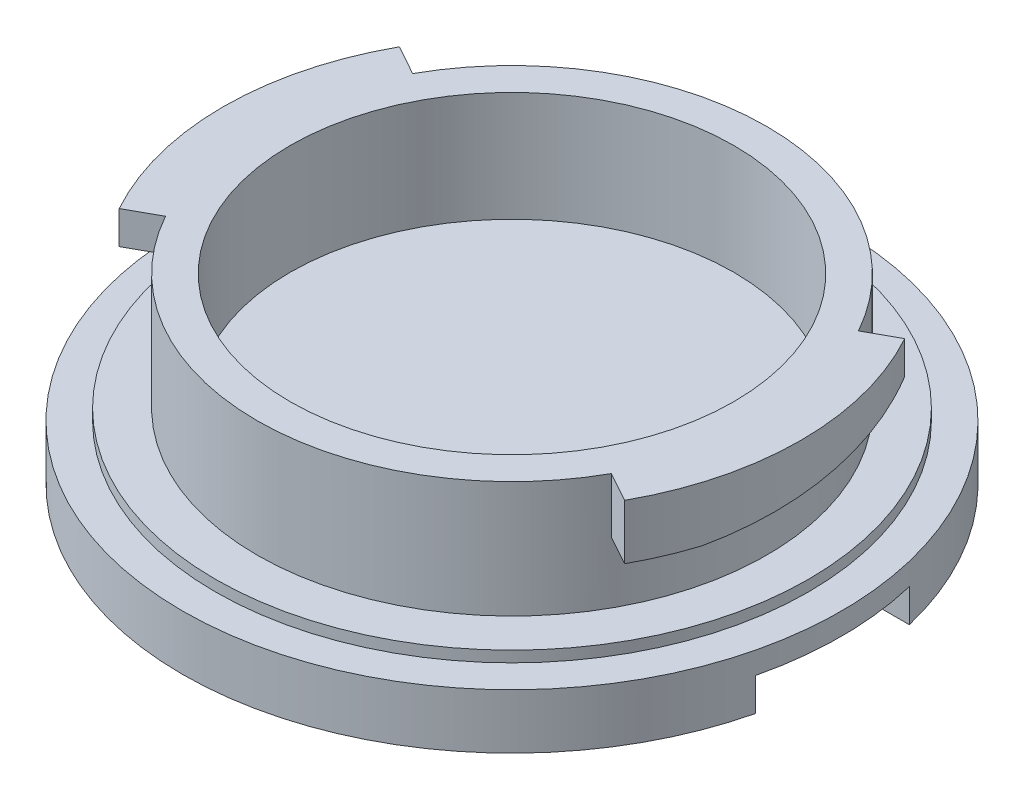
from build123d import *

# Parameters (mm, degrees)
SKETCH1_R           = 15
BOSS_EXTRUDE1_DEPTH = 2.5
SKETCH2_R           = 13.5
BOSS_EXTRUDE2_DEPTH = 0.5
SKETCH3_R           = 11.6
BOSS_EXTRUDE3_DEPTH = 5.3
SKETCH4_R           = 10.1
CUT_EXTRUDE1_DEPTH  = 5
CUT_EXTRUDE2_DEPTH  = 2
BOSS_EXTRUDE4_START = -2.5
BOSS_EXTRUDE4_DEPTH = 2.5
CUT_EXTRUDE3_DEPTH  = 1.5
CHAMFER1_SIZE       = 1.5
CHAMFER3_SIZE       = 1
CHAMFER3_SIZE_2     = 9.514364454


# Some blends are built 0.0001 mm under size
with BuildPart() as part:
    # Sketch1 → Boss-Extrude1 (new body)
    with BuildSketch(Plane(origin=(0, 0, 0), x_dir=(1, 0, 0), z_dir=(0, 1, 0))):
        with Locations(Location((0, 0, 0), (0, 0, 270))):
            Circle(SKETCH1_R)
    extrude(amount=BOSS_EXTRUDE1_DEPTH)

    # Sketch2 → Boss-Extrude2 (add)
    with BuildSketch(Plane(origin=(0, 2.5, 0), x_dir=(1, 0, 0), z_dir=(0, 1, 0))):
        with Locations(Location((0, 0, 0), (0, 0, 270))):
            Circle(SKETCH2_R)
    extrude(amount=BOSS_EXTRUDE2_DEPTH)

    # Sketch3 → Boss-Extrude3 (add)
    with BuildSketch(Plane(origin=(0, 3, 0), x_dir=(1, 0, 0), z_dir=(0, 1, 0))):
        with Locations(Location((0, 0, 0), (0, 0, 270))):
            Circle(SKETCH3_R)
    extrude(amount=BOSS_EXTRUDE3_DEPTH)

    # Sketch4 → Cut-Extrude1 (cut)
    with BuildSketch(Plane(origin=(0, 8.3, 0), x_dir=(1, 0, 0), z_dir=(0, 1, 0))):
        with Locations(Location((0, 0, 0), (0, 0, 270))):
            Circle(SKETCH4_R)
    extrude(amount=-CUT_EXTRUDE1_DEPTH, mode=Mode.SUBTRACT)

    # Sketch6 → Cut-Extrude2 (cut)
    with BuildSketch(Plane.XZ):
        with BuildLine():
            ThreePointArc((9.797958971, 2), (0, 10), (-9.797958971, 2))
            Line((-9.797958971, 2), (9.797958971, 2))
        make_face()
        with BuildLine():
            Line((9.797958971, -2), (-9.797958971, -2))
            ThreePointArc((-9.797958971, -2), (0, -10), (9.797958971, -2))
        make_face()
    extrude(amount=-CUT_EXTRUDE2_DEPTH, mode=Mode.SUBTRACT)

    # Sketch7 → Boss-Extrude4 (add)
    with BuildSketch(Plane(origin=(0, 8.3, 0), x_dir=(1, 0, 0), z_dir=(0, 1, 0)).offset(BOSS_EXTRUDE4_START)):
        with BuildLine():
            ThreePointArc((11.6, 0), (11.230512628, -2.904408047), (10.145588603, -5.623791595))
            Line((10.145588603, -5.623791595), (11.501249149, -6.375246506))
            ThreePointArc((11.501249149, -6.375246506), (12.731141471, -3.292497053), (13.15, 0))
            ThreePointArc((13.15, 0), (12.731141471, 3.292497053), (11.501249149, 6.375246506))
            Line((11.501249149, 6.375246506), (10.145588603, 5.623791595))
            ThreePointArc((10.145588603, 5.623791595), (11.230512628, 2.904408047), (11.6, 0))
        make_face()
        with BuildLine():
            Line((-11.501249149, -6.375246506), (-10.145588603, -5.623791595))
            ThreePointArc((-10.145588603, -5.623791595), (-11.6, 0), (-10.145588603, 5.623791595))
            Line((-10.145588603, 5.623791595), (-11.501249149, 6.375246506))
            ThreePointArc((-11.501249149, 6.375246506), (-13.15, 0), (-11.501249149, -6.375246506))
        make_face()
    extrude(amount=BOSS_EXTRUDE4_DEPTH)

    # Sketch8 → Cut-Extrude3 (cut)
    with BuildSketch(Plane.XZ):
        with BuildLine():
            Line((13, 3.5), (13, -3.5))
            Line((13, -3.5), (14.585952146, -3.5))
            ThreePointArc((14.585952146, -3.5), (14.896128393, -1.762202856), (15, 0))
            ThreePointArc((15, 0), (14.896128393, 1.762202856), (14.585952146, 3.5))
            Line((14.585952146, 3.5), (13, 3.5))
        make_face()
        with BuildLine():
            ThreePointArc((-14.585952146, 3.5), (-15, 0), (-14.585952146, -3.5))
            Line((-14.585952146, -3.5), (-13, -3.5))
            Line((-13, -3.5), (-13, 3.5))
            Line((-13, 3.5), (-14.585952146, 3.5))
        make_face()
    extrude(amount=-CUT_EXTRUDE3_DEPTH, mode=Mode.SUBTRACT)

    # Chamfer1
    chamfer1_edges = [part.edges().sort_by_distance(p)[0] for p in [
        (13, 1.5, 0),
        (-13, 1.5, 0),
    ]]
    chamfer(chamfer1_edges, length=CHAMFER1_SIZE - 0.0001)  # a hair under: the kernel refuses the full size

    # Chamfer3
    # the kernel refuses this chamfer: 9.514364454, 1 mm, written as the material it takes off along each edge
    with BuildSketch(Plane(origin=(33.132637154, 5.8, -18.365720673), x_dir=(-0.1658303097717397, 0.9396808679591152, -0.29916579809967064), z_dir=(-0.874619707139395, 0, 0.4848096202463386))) as chamfer3_piece_1_section:
        Polygon((CHAMFER3_SIZE * 0.939680867959, -CHAMFER3_SIZE * 0.342052432226), (-CHAMFER3_SIZE_2 * 0.342052432234, -CHAMFER3_SIZE_2 * 0.939680867981), (0, 0), align=None)
    chamfer3_piece_1 = extrude(amount=51.014670938, mode=Mode.PRIVATE)
    chamfer3_piece_1 = chamfer3_piece_1 - Plane(origin=(0, 6.124739453, 0), x_dir=(0, 0, 1), z_dir=(0, -1, 0)) * Cylinder(11.6, 138, mode=Mode.PRIVATE)
    add(chamfer3_piece_1, mode=Mode.SUBTRACT)
    with BuildSketch(Plane(origin=(-33.132637154, 5.8, 18.365720673), x_dir=(0.16583030977173743, 0.9396808679591152, 0.2991657980996716), z_dir=(0.8746197071393984, 0, -0.48480962024633234))) as chamfer3_piece_2_section:
        Polygon((CHAMFER3_SIZE * 0.939680867959, -CHAMFER3_SIZE * 0.342052432226), (-CHAMFER3_SIZE_2 * 0.342052432234, -CHAMFER3_SIZE_2 * 0.939680867981), (0, 0), align=None)
    chamfer3_piece_2 = extrude(amount=51.014670938, mode=Mode.PRIVATE)
    chamfer3_piece_2 = chamfer3_piece_2 - Plane(origin=(0, 6.124739453, 0), x_dir=(0, 0, 1), z_dir=(0, -1, 0)) * Cylinder(11.6, 138, mode=Mode.PRIVATE)
    add(chamfer3_piece_2, mode=Mode.SUBTRACT)


solid = part.part
